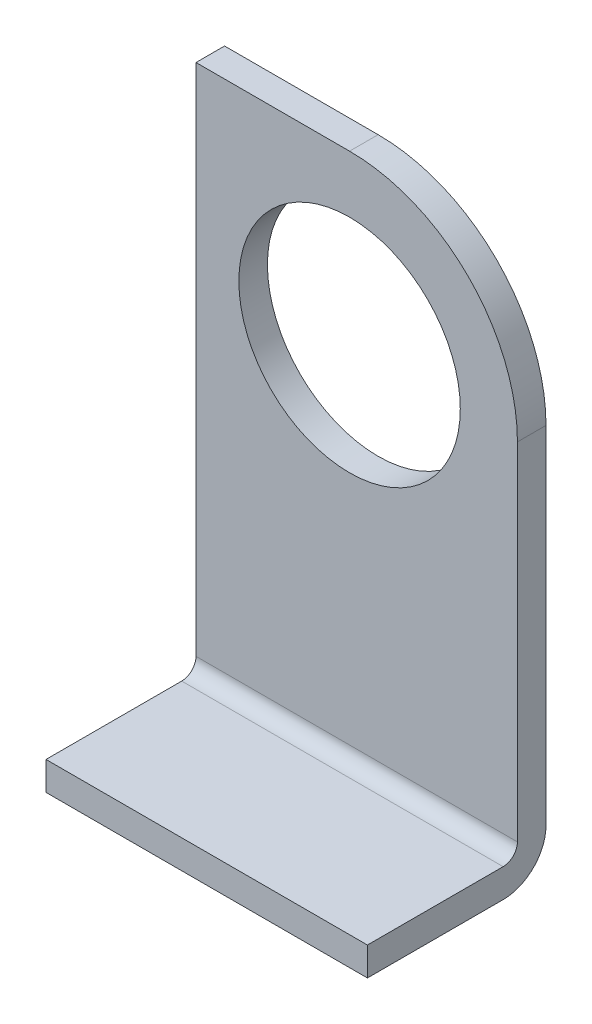
from build123d import *

# Parameters (mm, degrees)
SKETCH1_W               = 22.5
SKETCH1_H               = 12.5
BOSS_EXTRUDE1_DEPTH     = 2
SKETCH2_W               = 22.5
SKETCH2_H               = 37
BOSS_EXTRUDE2_DEPTH     = 2
FILLET1_R               = 1
FILLET2_R               = 3
SKETCH5_R               = 7.75
CUT_EXTRUDE1_DEPTH      = 2
CUT_EXTRUDE2_DEPTH      = 47.72793597
CUT_EXTRUDE2_DEPTH_BACK = 2


with BuildPart() as part:
    # Sketch1 → Boss-Extrude1 (new body)
    with BuildSketch(Plane(origin=(0, 0, 0), x_dir=(1, 0, 0), z_dir=(0, 1, 0))):
        with Locations((11.25, 6.25)):
            Rectangle(SKETCH1_W, SKETCH1_H)
    extrude(amount=BOSS_EXTRUDE1_DEPTH)

    # Sketch2 → Boss-Extrude2 (add)
    with BuildSketch(Plane(origin=(0, 0, -12.5), x_dir=(-1, 0, 0), z_dir=(0, 0, -1))):
        with Locations((-11.25, 20.5)):
            Rectangle(SKETCH2_W, SKETCH2_H)
    extrude(amount=-BOSS_EXTRUDE2_DEPTH)

    # Fillet1
    fillet1_edges = [part.edges().sort_by_distance(p)[0] for p in [
        (11.25, 2, -10.5),
    ]]
    fillet(fillet1_edges, radius=FILLET1_R)

    # Fillet2
    fillet2_edges = [part.edges().sort_by_distance(p)[0] for p in [
        (11.25, 0, -12.5),
    ]]
    fillet(fillet2_edges, radius=FILLET2_R)

    # Sketch5 → Cut-Extrude1 (cut)
    with BuildSketch(Plane(origin=(0, 0, -12.5), x_dir=(-1, 0, 0), z_dir=(0, 0, -1))):
        with Locations((-10.75, 27.25)):
            Circle(SKETCH5_R)
    extrude(amount=-CUT_EXTRUDE1_DEPTH, mode=Mode.SUBTRACT)

    # Sketch6 → Cut-Extrude2 (cut, two sides: drawn at the far end of the back side and taken through both)
    with BuildSketch(Plane(origin=(0, 0, -12.5), x_dir=(-1, 0, 0), z_dir=(0, 0, -1)).offset(-CUT_EXTRUDE2_DEPTH_BACK)):
        with BuildLine():
            Line((-22.5, -64.213181868), (-22.5, 27.25))
            ThreePointArc((-22.5, 27.25), (-19.058504679, 35.558504679), (-10.75, 39))
            Line((-10.75, 39), (80.713181868, 39))
            Line((80.713181868, 39), (-48.635290387, 168.348472255))
            Line((-48.635290387, 168.348472255), (-151.848472255, 65.135290387))
            Line((-151.848472255, 65.135290387), (-22.5, -64.213181868))
        make_face()
    extrude(amount=CUT_EXTRUDE2_DEPTH + CUT_EXTRUDE2_DEPTH_BACK, mode=Mode.SUBTRACT)


solid = part.part
